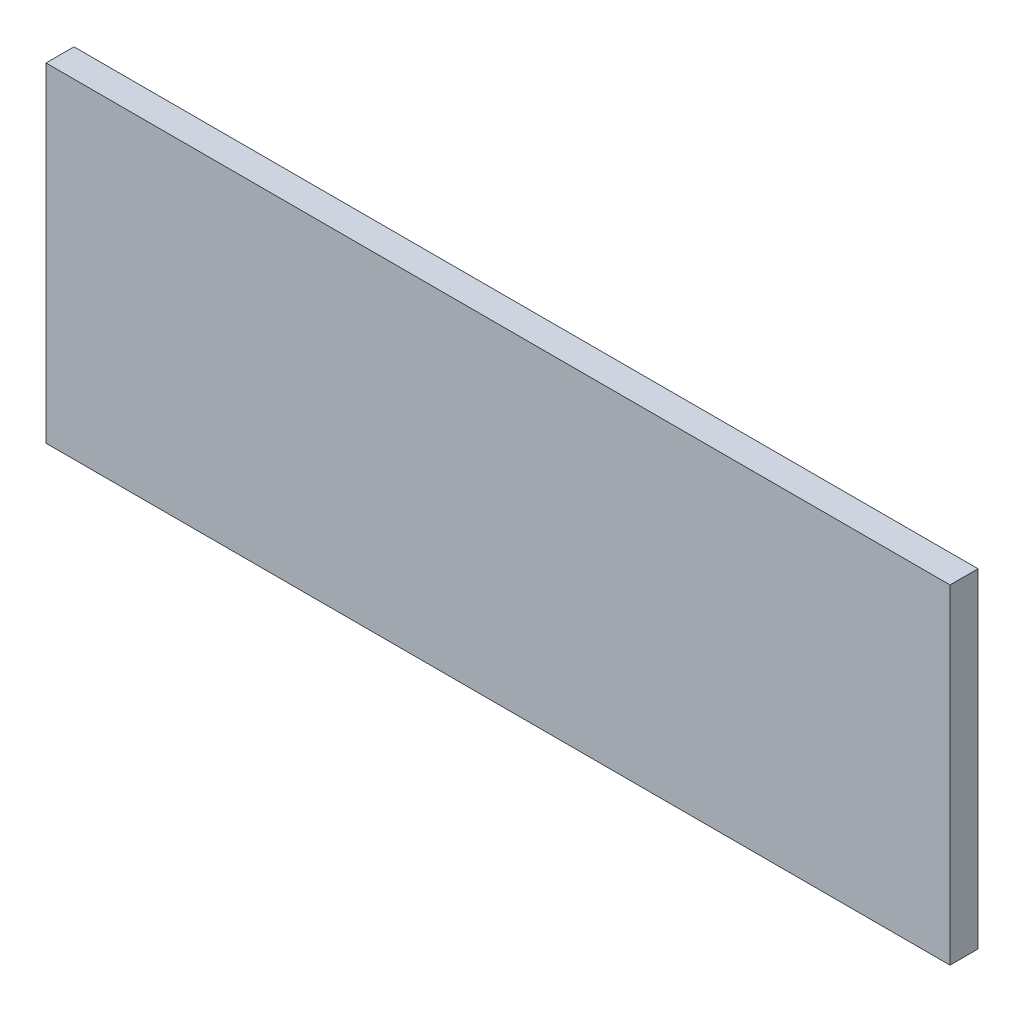
from build123d import *

# Parameters (mm, degrees)
SKETCH_1_W      = 420
SKETCH_1_H      = 153
EXTRUDE_1_DEPTH = 13


with BuildPart() as part:
    # ｽｹｯﾁ1 → ﾎﾞｽ - 押し出し1 (new body)
    with BuildSketch(Plane.XY):
        with Locations((140.719868277, 85.007142857)):
            Rectangle(SKETCH_1_W, SKETCH_1_H)
    extrude(amount=EXTRUDE_1_DEPTH)


solid = part.part
